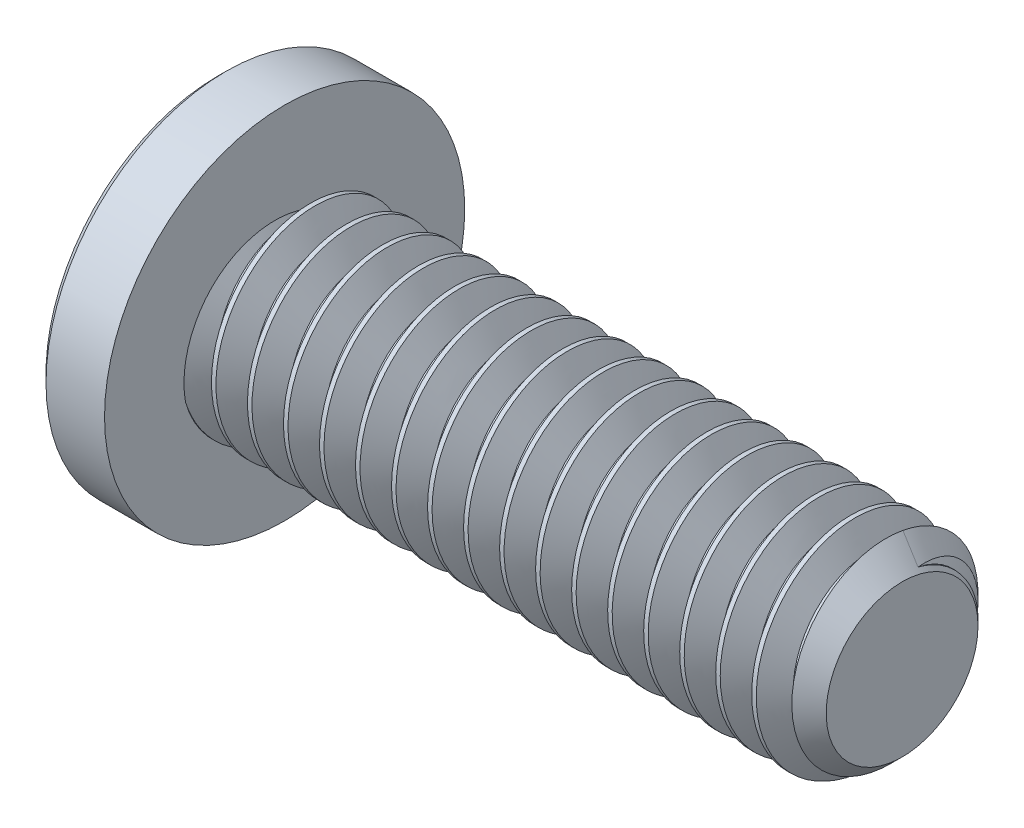
from build123d import *

# Parameters (mm, degrees)
SKETCH2_R           = 2
BOSS_EXTRUDE1_DEPTH = 12
CHAMFER1_SIZE       = 0.525
CUT_SWEEP1_PITCH    = 0.7
CUT_EXTRUDE1_DEPTH  = 2.42


with BuildPart() as part:
    # Sketch2 → Boss-Extrude1 (new body)
    with BuildSketch(Plane(origin=(6, 0, 0), x_dir=(0, 0, -1), z_dir=(1, 0, 0))):
        Circle(SKETCH2_R)
    extrude(amount=-BOSS_EXTRUDE1_DEPTH)

    # Chamfer1
    chamfer1_edges = [part.edges().sort_by_distance(p)[0] for p in [
        (6, 0, 2),
    ]]
    chamfer(chamfer1_edges, length=CHAMFER1_SIZE)

    # Cut-Sweep1: the profile of Sketch5 profile screwed along a right-hand helix of 18.142857 turns, 6 arcs to a turn; built about Z, then put on its axis
    cut_sweep1_z = Axis((0, 0, 0), (0, 0, 1))
    cut_sweep1_corners = [(2.0003, 0, 0.306423205), (2.0003, 0, -0.306423205), (1.545336663, 0, -0.04375), (1.545336663, 0, 0.04375)]
    with BuildLine(mode=Mode.PRIVATE) as cut_sweep1_profile:
        Line(cut_sweep1_corners[0], cut_sweep1_corners[1])
        Line(cut_sweep1_corners[1], cut_sweep1_corners[2])
        Line(cut_sweep1_corners[2], cut_sweep1_corners[3])
        Line(cut_sweep1_corners[3], cut_sweep1_corners[0])
    cut_sweep1_cap = Face(cut_sweep1_profile.wire())
    cut_sweep1_turn_angles = [0, 30, 60, 90, 120, 150, 180, 210, 240, 270, 300, 330, 360]
    cut_sweep1_turn_weights = [1, 0.8660254037844387, 1, 0.8660254037844387, 1, 0.8660254037844387, 1, 0.8660254037844387, 1, 0.8660254037844387, 1, 0.8660254037844387, 1]
    cut_sweep1_turn_rails = [Edge.make_bspline([Vector(p[0], p[1], 0).rotate(cut_sweep1_z, cut_sweep1_turn_angles[k]) / cut_sweep1_turn_weights[k] + Vector(0, 0, p[2] + CUT_SWEEP1_PITCH * cut_sweep1_turn_angles[k] / 360) for k in range(13)], [0, 0, 0, 1, 1, 2, 2, 3, 3, 4, 4, 5, 5, 6, 6, 6], 2, cut_sweep1_turn_weights) for p in cut_sweep1_corners]
    cut_sweep1_turn_sides = [Face.make_surface_from_curves(cut_sweep1_turn_rails[p[0]], cut_sweep1_turn_rails[p[1]]) for p in [(0, 1), (1, 2), (2, 3), (3, 0)]]
    cut_sweep1_last_angles = [6480, 6505.714285714, 6531.428571429]
    cut_sweep1_last_weights = [1, 0.9009688679026391, 1]
    cut_sweep1_last_rails = [Edge.make_bspline([Vector(p[0], p[1], 0).rotate(cut_sweep1_z, cut_sweep1_last_angles[k]) / cut_sweep1_last_weights[k] + Vector(0, 0, p[2] + CUT_SWEEP1_PITCH * cut_sweep1_last_angles[k] / 360) for k in range(3)], [0, 0, 0, 1, 1, 1], 2, cut_sweep1_last_weights) for p in cut_sweep1_corners]
    cut_sweep1_last_sides = [Face.make_surface_from_curves(cut_sweep1_last_rails[p[0]], cut_sweep1_last_rails[p[1]]) for p in [(0, 1), (1, 2), (2, 3), (3, 0)]]
    cut_sweep1 = Plane(origin=(6, 0, 0), x_dir=(0, 1, 0), z_dir=(-1, 0, 0)) * Solid(Shell([*[p.moved(Location((0, 0, CUT_SWEEP1_PITCH * i))) for i in range(18) for p in cut_sweep1_turn_sides], *cut_sweep1_last_sides, cut_sweep1_cap, cut_sweep1_cap.rotate(cut_sweep1_z, 6531.428571429).moved(Location((0, 0, CUT_SWEEP1_PITCH * 6531.428571429 / 360)))]))
    add(cut_sweep1, mode=Mode.SUBTRACT)

    # Sketch6 → Revolve1 (revolve)
    with BuildSketch(Plane.XY, mode=Mode.PRIVATE) as revolve1_sk:
        Polygon((-7.1375, 3.5), (-7.3, 3.3375), (-7.3, 0), (-6, 0), (-6, 3.5), align=None)
    revolve(revolve1_sk.sketch.rotate(Axis((-6, 0, 0), (-1, 0, 0)), 14.209880149), axis=Axis((-6, 0, 0), (-1, 0, 0)))

    # Sketch4 → Cut-Extrude1 (cut)
    with BuildSketch(Plane(origin=(-7.3, 0, 0), x_dir=(0, 0, -1), z_dir=(1, 0, 0))):
        Polygon((0, 1.443375673), (-1.25, 0.721687836), (-1.25, -0.721687836), (0, -1.443375673), (1.25, -0.721687836), (1.25, 0.721687836), align=None)
    extrude(amount=CUT_EXTRUDE1_DEPTH, mode=Mode.SUBTRACT)

    # Cut-Extrude2 cone 1 section (through the dimple's axis) → Cut-Extrude2 (revolve, cut)
    with BuildSketch(Plane(origin=(-7.3, 0, 0), x_dir=(0, 0, 1), z_dir=(0, 1, 0))):
        Polygon((0, 0), (1.443375673, 0), (0, 1.443375673), align=None)
    revolve(axis=Axis((-7.3, 0, 0), (1, 0, 0)), mode=Mode.SUBTRACT)


solid = part.part
